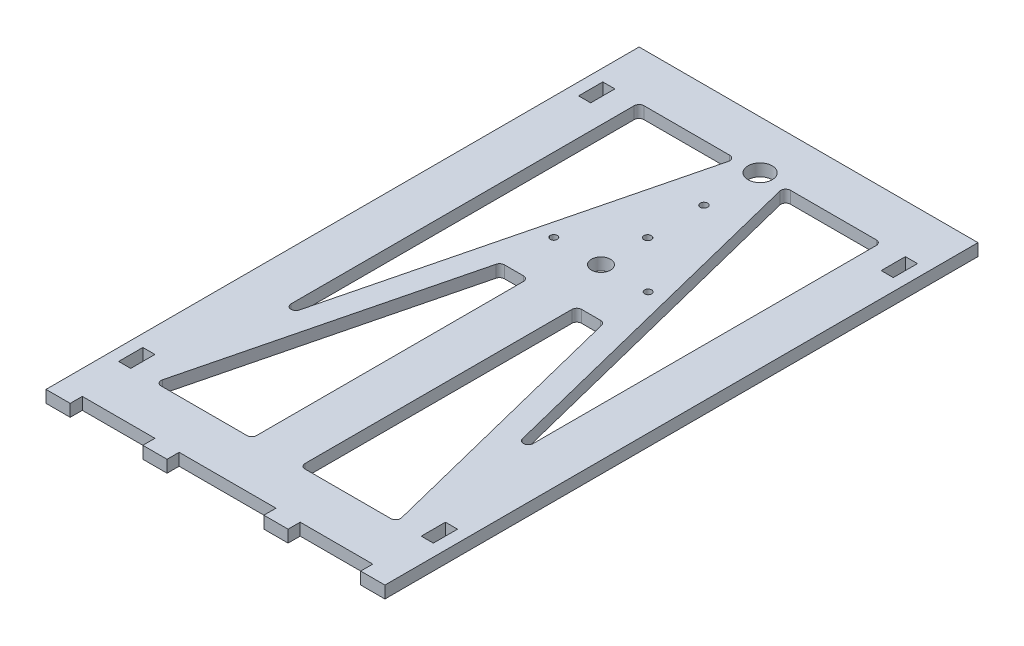
from build123d import *

# Parameters (mm, degrees)
SKETCH1_W         = 6.35
SKETCH1_H         = 12.7
SKETCH1_R         = 1.8542
SKETCH1_R_2       = 1.93499994
SKETCH1_R_3       = 5.000000033
SKETCH1_R_4       = 6.35
FRONT_PANEL_DEPTH = 6.35
FILLET1_R         = 2.54


with BuildPart() as part:
    # Sketch1 → Front Panel (new body)
    with BuildSketch(Plane(origin=(0, 0, 0), x_dir=(1, 0, 0), z_dir=(0, 1, 0))):
        Polygon((0, 304.8), (0, -6.35), (12.7, -6.35), (12.7, 0), (50.8, 0), (50.8, -6.35), (63.5, -6.35), (63.5, 0), (114.3, 0), (114.3, -6.35), (127, -6.35), (127, 0), (165.1, 0), (165.1, -6.35), (177.8, -6.35), (177.8, 304.8), align=None)
        with Locations((9.525, 31.75)):
            Rectangle(SKETCH1_W, SKETCH1_H, mode=Mode.SUBTRACT)
        Polygon((76.2, 25.4), (25.4, 25.4), (61.675000031, 170.500000122), (76.2, 170.500000122), align=None, mode=Mode.SUBTRACT)
        with Locations((168.275, 31.75)):
            Rectangle(SKETCH1_W, SKETCH1_H, mode=Mode.SUBTRACT)
        Polygon((101.6, 25.4), (101.6, 170.500000122), (116.124999969, 170.500000122), (152.4, 25.4), align=None, mode=Mode.SUBTRACT)
        Polygon((25.4, 279.4), (76.2, 279.4), (25.4, 76.2), align=None, mode=Mode.SUBTRACT)
        with Locations((64.14999997, 195.900000122)):
            Circle(SKETCH1_R, mode=Mode.SUBTRACT)
        with Locations((88.9, 220.400000144)):
            Circle(SKETCH1_R_2, mode=Mode.SUBTRACT)
        with Locations((9.525, 273.05)):
            Rectangle(SKETCH1_W, SKETCH1_H, mode=Mode.SUBTRACT)
        with Locations((88.9, 249.900000072)):
            Circle(SKETCH1_R_2, mode=Mode.SUBTRACT)
        Polygon((152.4, 76.2), (101.6, 279.4), (152.4, 279.4), align=None, mode=Mode.SUBTRACT)
        with Locations((88.9, 195.900000122)):
            Circle(SKETCH1_R_3, mode=Mode.SUBTRACT)
        with Locations((113.65000003, 195.900000122)):
            Circle(SKETCH1_R, mode=Mode.SUBTRACT)
        with Locations((88.9, 279.4)):
            Circle(SKETCH1_R_4, mode=Mode.SUBTRACT)
        with Locations((168.275, 273.05)):
            Rectangle(SKETCH1_W, SKETCH1_H, mode=Mode.SUBTRACT)
    extrude(amount=FRONT_PANEL_DEPTH)

    # Fillet1
    fillet1_edges = [part.edges().sort_by_distance(p)[0] for p in [
        (152.4, 3.175, -76.2),
        (152.4, 3.175, -279.4),
        (101.6, 3.175, -279.4),
        (76.2, 3.175, -279.4),
        (25.4, 3.175, -279.4),
        (25.4, 3.175, -76.2),
        (152.4, 3.175, -25.4),
        (101.6, 3.175, -25.4),
        (76.2, 3.175, -25.4),
        (25.4, 3.175, -25.4),
        (61.675000031, 3.175, -170.500000122),
        (76.2, 3.175, -170.500000122),
        (116.124999969, 3.175, -170.500000122),
        (101.6, 3.175, -170.500000122),
    ]]
    fillet(fillet1_edges, radius=FILLET1_R)


solid = part.part
